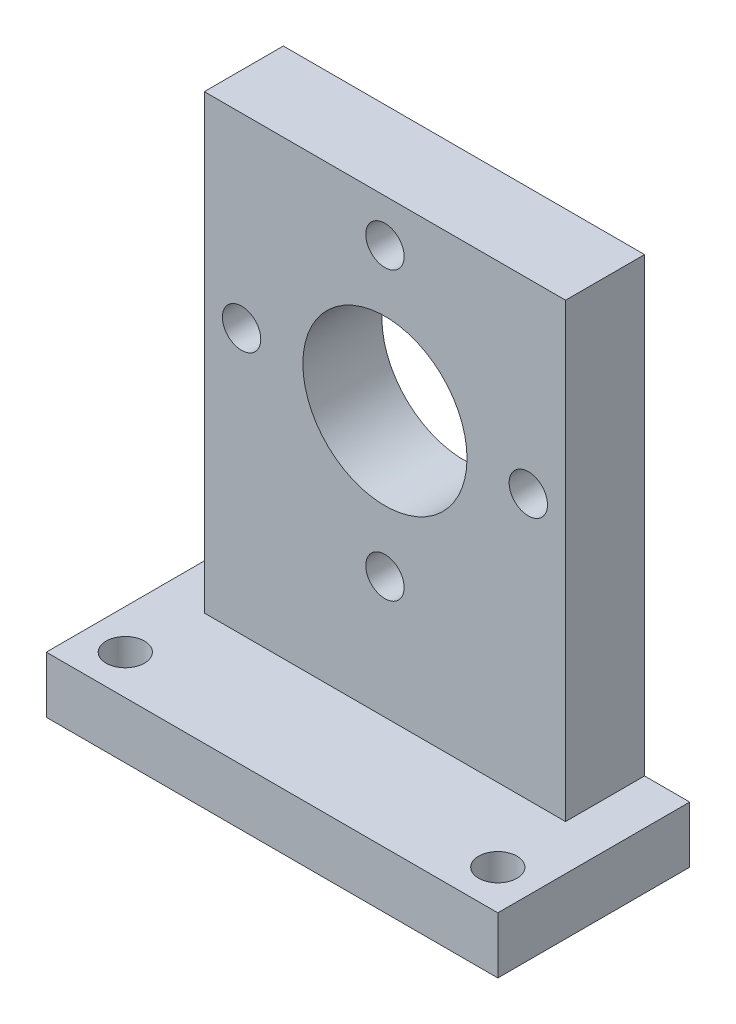
from build123d import *

# Parameters (mm, degrees)
SKETCH1_W           = 40
SKETCH1_H           = 27
SKETCH1_W_2         = 32
SKETCH1_H_2         = 7
BOSS_EXTRUDE1_DEPTH = 5
SKETCH1_3_W         = 32
SKETCH1_3_H         = 7
BOSS_EXTRUDE2_DEPTH = 45
CUT_EXTRUDE1_REACH  = 54.096
SKETCH2_R           = 7.27075
CUT_EXTRUDE2_REACH  = 54.096
SKETCH4_R           = 1.7
CUT_EXTRUDE3_REACH  = 48.715
SKETCH5_R           = 1.7
CUT_EXTRUDE5_REACH  = 48.715
SKETCH7_W           = 40
SKETCH7_H           = 10
SKETCH8_R           = 1.7
CUT_EXTRUDE6_DEPTH  = 6.35


with BuildPart() as part:
    # Sketch1 → Boss-Extrude1 (new body)
    with BuildSketch(Plane(origin=(0, 0, 0), x_dir=(1, 0, 0), z_dir=(0, 1, 0))):
        Rectangle(SKETCH1_W, SKETCH1_H)
        Rectangle(SKETCH1_W_2, SKETCH1_H_2, mode=Mode.SUBTRACT)
    extrude(amount=BOSS_EXTRUDE1_DEPTH)

    # Sketch1<3> → Boss-Extrude2 (add)
    with BuildSketch(Plane(origin=(0, 0, 0), x_dir=(1, 0, 0), z_dir=(0, 1, 0))):
        Rectangle(SKETCH1_3_W, SKETCH1_3_H)
    extrude(amount=BOSS_EXTRUDE2_DEPTH)

    # Sketch2 → Cut-Extrude1 (cut, up to next)
    with BuildSketch(Plane.XY.offset(3.5), mode=Mode.PRIVATE) as cut_extrude1_sk1:
        with Locations((0, 28.5)):
            Circle(SKETCH2_R)
    cut_extrude1_tool1 = extrude(cut_extrude1_sk1.sketch, amount=-CUT_EXTRUDE1_REACH, mode=Mode.PRIVATE) & part.part
    add(cut_extrude1_tool1.solids().sort_by_distance((0, 28.5, 3.5))[0], mode=Mode.SUBTRACT)

    # Sketch4 → Cut-Extrude2 (cut, up to next)
    with BuildSketch(Plane.XY.offset(3.5), mode=Mode.PRIVATE) as cut_extrude2_sk1:
        with Locations((0, 41.2)):
            Circle(SKETCH4_R)
    cut_extrude2_tool1 = extrude(cut_extrude2_sk1.sketch, amount=-CUT_EXTRUDE2_REACH, mode=Mode.PRIVATE) & part.part
    # Sketch4 → Cut-Extrude2 (cut, up to next)
    with BuildSketch(Plane.XY.offset(3.5), mode=Mode.PRIVATE) as cut_extrude2_sk2:
        with Locations((12.7, 28.5)):
            Circle(SKETCH4_R)
    cut_extrude2_tool2 = extrude(cut_extrude2_sk2.sketch, amount=-CUT_EXTRUDE2_REACH, mode=Mode.PRIVATE) & part.part
    # Sketch4 → Cut-Extrude2 (cut, up to next)
    with BuildSketch(Plane.XY.offset(3.5), mode=Mode.PRIVATE) as cut_extrude2_sk3:
        with Locations((0, 15.8)):
            Circle(SKETCH4_R)
    cut_extrude2_tool3 = extrude(cut_extrude2_sk3.sketch, amount=-CUT_EXTRUDE2_REACH, mode=Mode.PRIVATE) & part.part
    # Sketch4 → Cut-Extrude2 (cut, up to next)
    with BuildSketch(Plane.XY.offset(3.5), mode=Mode.PRIVATE) as cut_extrude2_sk4:
        with Locations((-12.7, 28.5)):
            Circle(SKETCH4_R)
    cut_extrude2_tool4 = extrude(cut_extrude2_sk4.sketch, amount=-CUT_EXTRUDE2_REACH, mode=Mode.PRIVATE) & part.part
    add(cut_extrude2_tool1.solids().sort_by_distance((0, 41.2, 3.5))[0], mode=Mode.SUBTRACT)
    add(cut_extrude2_tool2.solids().sort_by_distance((12.7, 28.5, 3.5))[0], mode=Mode.SUBTRACT)
    add(cut_extrude2_tool3.solids().sort_by_distance((0, 15.8, 3.5))[0], mode=Mode.SUBTRACT)
    add(cut_extrude2_tool4.solids().sort_by_distance((-12.7, 28.5, 3.5))[0], mode=Mode.SUBTRACT)

    # Sketch5 → Cut-Extrude3 (cut, up to next)
    with BuildSketch(Plane(origin=(0, 5, 0), x_dir=(1, 0, 0), z_dir=(0, 1, 0)), mode=Mode.PRIVATE) as cut_extrude3_sk1:
        with Locations((-16.5, 10)):
            Circle(SKETCH5_R)
    cut_extrude3_tool1 = extrude(cut_extrude3_sk1.sketch, amount=-CUT_EXTRUDE3_REACH, mode=Mode.PRIVATE) & part.part
    # Sketch5 → Cut-Extrude3 (cut, up to next)
    with BuildSketch(Plane(origin=(0, 5, 0), x_dir=(1, 0, 0), z_dir=(0, 1, 0)), mode=Mode.PRIVATE) as cut_extrude3_sk2:
        with Locations((-16.5, -10)):
            Circle(SKETCH5_R)
    cut_extrude3_tool2 = extrude(cut_extrude3_sk2.sketch, amount=-CUT_EXTRUDE3_REACH, mode=Mode.PRIVATE) & part.part
    # Sketch5 → Cut-Extrude3 (cut, up to next)
    with BuildSketch(Plane(origin=(0, 5, 0), x_dir=(1, 0, 0), z_dir=(0, 1, 0)), mode=Mode.PRIVATE) as cut_extrude3_sk3:
        with Locations((16.5, -10)):
            Circle(SKETCH5_R)
    cut_extrude3_tool3 = extrude(cut_extrude3_sk3.sketch, amount=-CUT_EXTRUDE3_REACH, mode=Mode.PRIVATE) & part.part
    # Sketch5 → Cut-Extrude3 (cut, up to next)
    with BuildSketch(Plane(origin=(0, 5, 0), x_dir=(1, 0, 0), z_dir=(0, 1, 0)), mode=Mode.PRIVATE) as cut_extrude3_sk4:
        with Locations((16.5, 10)):
            Circle(SKETCH5_R)
    cut_extrude3_tool4 = extrude(cut_extrude3_sk4.sketch, amount=-CUT_EXTRUDE3_REACH, mode=Mode.PRIVATE) & part.part
    add(cut_extrude3_tool1.solids().sort_by_distance((-16.5, 5, -10))[0], mode=Mode.SUBTRACT)
    add(cut_extrude3_tool2.solids().sort_by_distance((-16.5, 5, 10))[0], mode=Mode.SUBTRACT)
    add(cut_extrude3_tool3.solids().sort_by_distance((16.5, 5, 10))[0], mode=Mode.SUBTRACT)
    add(cut_extrude3_tool4.solids().sort_by_distance((16.5, 5, -10))[0], mode=Mode.SUBTRACT)

    # Sketch7 → Cut-Extrude5 (cut, up to next)
    with BuildSketch(Plane(origin=(0, 5, 0), x_dir=(1, 0, 0), z_dir=(0, 1, 0)), mode=Mode.PRIVATE) as cut_extrude5_sk1:
        with Locations((0, 8.5)):
            Rectangle(SKETCH7_W, SKETCH7_H)
    cut_extrude5_tool1 = extrude(cut_extrude5_sk1.sketch, amount=-CUT_EXTRUDE5_REACH, mode=Mode.PRIVATE) & part.part
    add(cut_extrude5_tool1.solids().sort_by_distance((0, 5, -8.5))[0], mode=Mode.SUBTRACT)

    # Sketch8 → Cut-Extrude6 (cut)
    with BuildSketch(Plane(origin=(0, 0, -3.5), x_dir=(-1, 0, 0), z_dir=(0, 0, -1))):
        with Locations((-12.7, 2.5)):
            Circle(SKETCH8_R)
        with Locations((12.7, 2.5)):
            Circle(SKETCH8_R)
    extrude(amount=-CUT_EXTRUDE6_DEPTH, mode=Mode.SUBTRACT)


solid = part.part
